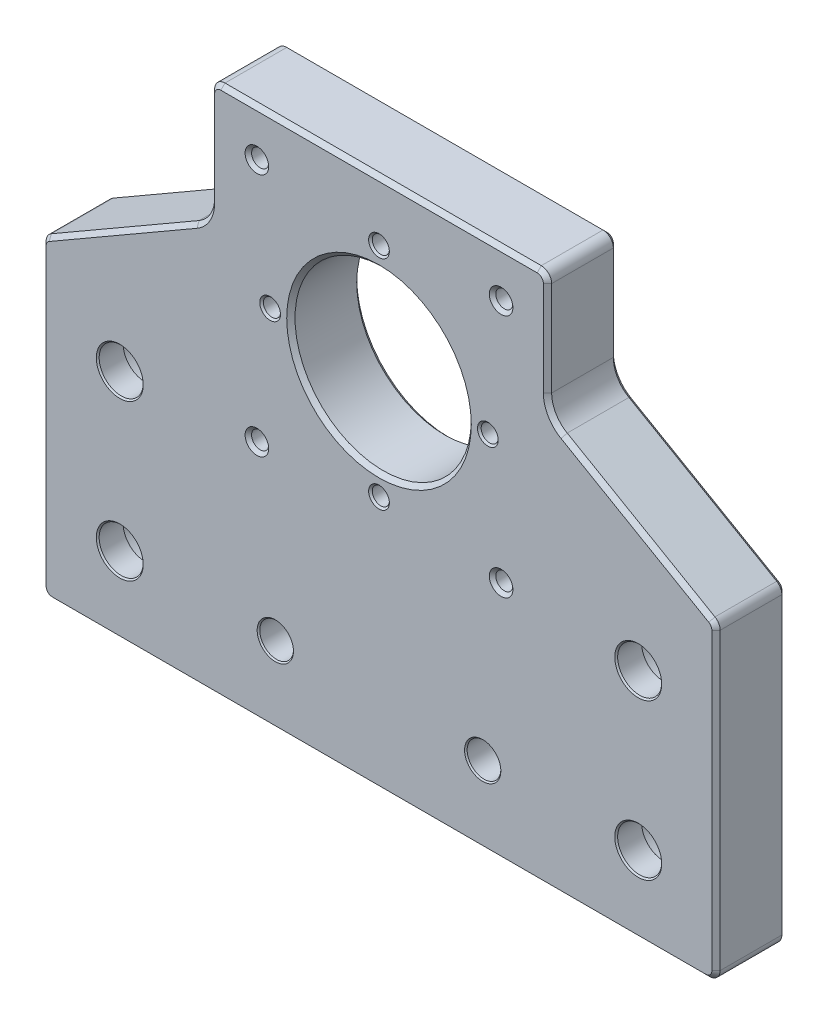
from build123d import *
from build123d.topology import SkipClean

# Parameters (mm, degrees)
BASE_FLANGE1_DEPTH                           = 13.5
CBORE_FOR_M8_HEX_SOCKET_HEAD_CAP_SCR_2_COUNT = 2
CBORE_FOR_M8_HEX_SOCKET_HEAD_CAP_SCR_2_PITCH = 30
M4_TAPPED_HOLE1_AT_2_COUNT                   = 2
M4_TAPPED_HOLE1_AT_2_PITCH                   = 29.69848481
M4_TAPPED_HOLE1_AT_3_COUNT                   = 2
M4_TAPPED_HOLE1_AT_3_PITCH                   = 42
M4_TAPPED_HOLE1_AT_4_COUNT                   = 2
M4_TAPPED_HOLE1_AT_4_PITCH                   = 29.69848481
CIRPATTERN1_COUNT                            = 4
FILLET2_R                                    = 6
FILLET1_R                                    = 2
CHAMFER1_SIZE                                = 0.8


# Sheet-metal steps are written as plain solids
with BuildPart() as part:
    # Sketch1 → Base-Flange1 (new body)
    with BuildSketch(Plane.XY):
        with BuildLine():
            Line((0, 0), (-65, 0))
            Line((-65, 0), (-65, 60))
            Line((-65, 60), (-32.5, 78.763883749))
            Line((-32.5, 78.763883749), (-32.5, 102.5))
            Line((-32.5, 102.5), (0, 102.5))
            Line((0, 102.5), (0, 87))
            ThreePointArc((0, 87), (-17, 70), (0, 53))
            Line((0, 53), (0, 0))
        make_face()
    extrude(amount=-BASE_FLANGE1_DEPTH)

    # Sketch7 → CBORE for M8 Hex Socket Head Cap Screw1 (revolve, cut)
    with BuildSketch(Plane(origin=(-50, 45, -13.5), x_dir=(0, 1, 0), z_dir=(1, 0, 0))):
        Polygon((0, 0), (0, 13.5), (4.525, 13.5), (4.25, 13.225), (4.25, 8.6), (7, 8.6), (7, 0.525), (7.525, 0), align=None)
    cbore_for_m8_hex_socket_head_cap_screw1 = revolve(axis=Axis((-50, 45, -19.85), (0, 0, 1)), mode=Mode.SUBTRACT)

    # CBORE for M8 Hex Socket Head Cap Scr 2: CBORE for M8 Hex Socket Head Cap Screw1 ×2
    with Locations(*[(0, -i * CBORE_FOR_M8_HEX_SOCKET_HEAD_CAP_SCR_2_PITCH, 0) for i in range(1, CBORE_FOR_M8_HEX_SOCKET_HEAD_CAP_SCR_2_COUNT)]):
        add(cbore_for_m8_hex_socket_head_cap_screw1, mode=Mode.SUBTRACT)

    # Sketch17 → CBORE for M6 Hex Socket Head Cap Screw1 (revolve, cut)
    with BuildSketch(Plane(origin=(-20, 15, -13.5), x_dir=(0, 1, 0), z_dir=(1, 0, 0))):
        Polygon((0, 0), (0, 13.5), (3.5, 13.5), (3.25, 13.25), (3.25, 6.5), (5.5, 6.5), (5.5, 0.25), (5.75, 0), align=None)
    revolve(axis=Axis((-20, 15, -19.85), (0, 0, 1)), mode=Mode.SUBTRACT)

    # Mirror1: part across plane


with BuildPart() as part_1:
    with SkipClean():  # the faces are left unmerged after this step: merging them gives an invalid solid
        add(part.part)
        add(part.part.mirror(Plane(origin=(0, 102.5, -13.5), x_dir=(0, 0, 1), z_dir=(1, 0, 0))))

    # Sketch12 → M4 Tapped Hole1 (revolve, cut)
    with SkipClean():  # the faces are left unmerged after this step: merging them gives an invalid solid
        with BuildSketch(Plane(origin=(-21, 70, 0), x_dir=(0, -1, 0), z_dir=(1, 0, 0))):
            Polygon((0, 0), (0, 13.5), (2, 13.5), (1.65, 13.15), (1.65, 0.35), (2, 0), align=None)
        m4_tapped_hole1 = revolve(axis=Axis((-21, 70, 6.35), (0, 0, -1)), mode=Mode.SUBTRACT)

    # M4 Tapped Hole1 at 2: M4 Tapped Hole1 ×2
    with SkipClean():  # the faces are left unmerged after this step: merging them gives an invalid solid
        with Locations(*[Vector(0.7071067811865477, 0.7071067811865474, 0) * (i * M4_TAPPED_HOLE1_AT_2_PITCH) for i in range(1, M4_TAPPED_HOLE1_AT_2_COUNT)]):
            add(m4_tapped_hole1, mode=Mode.SUBTRACT)

    # M4 Tapped Hole1 at 3: M4 Tapped Hole1 ×2
    with SkipClean():  # the faces are left unmerged after this step: merging them gives an invalid solid
        with Locations(*[(i * M4_TAPPED_HOLE1_AT_3_PITCH, 0, 0) for i in range(1, M4_TAPPED_HOLE1_AT_3_COUNT)]):
            add(m4_tapped_hole1, mode=Mode.SUBTRACT)

    # M4 Tapped Hole1 at 4: M4 Tapped Hole1 ×2
    with SkipClean():  # the faces are left unmerged after this step: merging them gives an invalid solid
        with Locations(*[Vector(0.7071067811865476, -0.7071067811865475, 0) * (i * M4_TAPPED_HOLE1_AT_4_PITCH) for i in range(1, M4_TAPPED_HOLE1_AT_4_COUNT)]):
            add(m4_tapped_hole1, mode=Mode.SUBTRACT)

    # Sketch15 → M4 Tapped Hole2 (revolve, cut)
    with SkipClean():  # the faces are left unmerged after this step: merging them gives an invalid solid
        with BuildSketch(Plane(origin=(23.550191347, 93.550191347, -13.5), x_dir=(0, 1, 0), z_dir=(1, 0, 0))):
            Polygon((0, 0), (0, 13.5), (2.275, 13.5), (1.65, 12.875), (1.65, 0.625), (2.275, 0), align=None)
        m4_tapped_hole2 = revolve(axis=Axis((23.550191347, 93.550191347, -19.85), (0, 0, 1)), mode=Mode.SUBTRACT)

    # CirPattern1: M4 Tapped Hole2 ×4 about axis
    with SkipClean():  # the faces are left unmerged after this step: merging them gives an invalid solid
        cirpattern1_axis = Axis((0, 70, 0), (0, 0, 1))
        for i in range(1, CIRPATTERN1_COUNT):
            add(m4_tapped_hole2.rotate(cirpattern1_axis, i * 360 / CIRPATTERN1_COUNT), mode=Mode.SUBTRACT)

    # Fillet2
    fillet2_edges = [part_1.edges().sort_by_distance(p)[0] for p in [
        (-32.5, 78.763883749, -6.75),
        (32.5, 78.763883749, -6.75),
    ]]
    fillet(fillet2_edges, radius=FILLET2_R)

    # Fillet1
    fillet1_edges = [part_1.edges().sort_by_distance(p)[0] for p in [
        (-65, 60, -6.75),
        (-32.5, 102.5, -6.75),
        (-65, 0, -6.75),
        (65, 60, -6.75),
        (32.5, 102.5, -6.75),
        (65, 0, -6.75),
    ]]
    fillet(fillet1_edges, radius=FILLET1_R)

    # Chamfer1
    chamfer1_edges = [part_1.edges().sort_by_distance(p)[0] for p in [
        (-17, 70, 0),
        (-17, 70, -13.5),
        (49.75, 68.804591605, 0),
        (49.75, 68.804591605, -13.5),
        (-49.75, 68.804591605, 0),
        (-49.75, 68.804591605, -13.5),
        (33.303847577, 79.227985364, 0),
        (33.303847577, 79.227985364, -13.5),
        (-33.303847577, 79.227985364, 0),
        (-33.303847577, 79.227985364, -13.5),
        (65, 30.422649731, 0),
        (65, 30.422649731, -13.5),
        (32.5, 91.363992682, 0),
        (-15.25, 102.5, 0),
        (-32.5, 91.363992682, 0),
        (-65, 30.422649731, 0),
        (-31.5, 0, 0),
        (-64.414213562, 0.585786438, 0),
        (64.414213562, 0.585786438, 0),
        (-31.914213562, 101.914213562, 0),
        (31.914213562, 101.914213562, 0),
        (-64.732050808, 59.845299462, 0),
        (64.732050808, 59.845299462, 0),
        (-15.25, 102.5, -13.5),
        (32.5, 91.363992682, -13.5),
        (-31.5, 0, -13.5),
        (-65, 30.422649731, -13.5),
        (-32.5, 91.363992682, -13.5),
        (-64.414213562, 0.585786438, -13.5),
        (64.414213562, 0.585786438, -13.5),
        (-31.914213562, 101.914213562, -13.5),
        (31.914213562, 101.914213562, -13.5),
        (-64.732050808, 59.845299462, -13.5),
        (64.732050808, 59.845299462, -13.5),
    ]]
    chamfer(chamfer1_edges, length=CHAMFER1_SIZE)


solid = part_1.part
